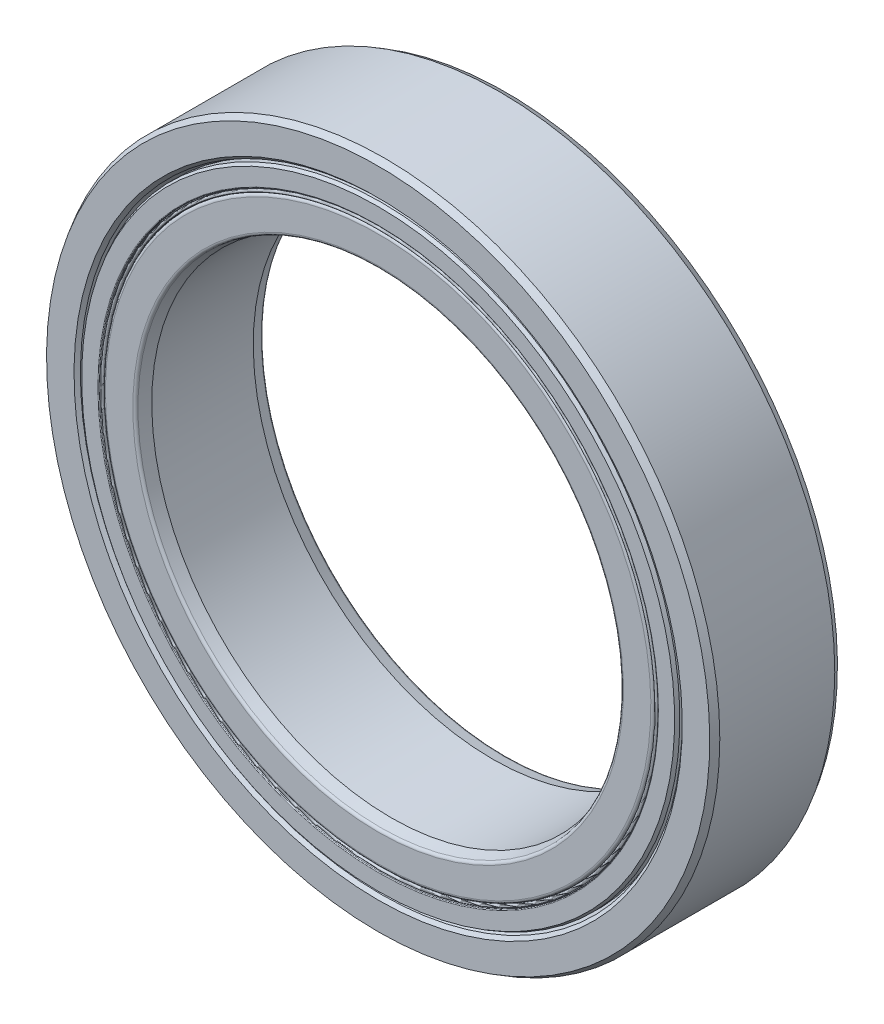
from build123d import *

# Parameters (mm, degrees)
CIRPATTERN1_COUNT = 16


with BuildPart() as part:
    # Sketch3 → Revolve1 (revolve)
    with BuildSketch(Plane(origin=(0, 0, 0), x_dir=(0, 0, -1), z_dir=(1, 0, 0))):
        with BuildLine():
            Line((-1.682987285, 9.345), (-1.9, 9.423986169))
            Line((-1.9, 9.423986169), (-2, 9.523986169))
            Line((-2, 9.523986169), (-2, 10.384529946))
            Line((-2, 10.384529946), (-1.8, 10.5))
            Line((-1.8, 10.5), (1.8, 10.5))
            Line((1.8, 10.5), (2, 10.384529946))
            Line((2, 10.384529946), (2, 9.523986169))
            Line((2, 9.523986169), (1.9, 9.423986169))
            Line((1.9, 9.423986169), (1.682987285, 9.345))
            Line((1.682987285, 9.345), (1.067520492, 9.345))
            ThreePointArc((1.067520492, 9.345), (0, 10.115), (-1.067520492, 9.345))
            Line((-1.067520492, 9.345), (-1.682987285, 9.345))
        make_face()
    revolve(axis=Axis((0, 0, 2), (0, 0, -1)))


with BuildPart() as body_2:
    # Sketch4 → Revolve2 (revolve)
    with BuildSketch(Plane(origin=(0, 0, 0), x_dir=(0, 0, -1), z_dir=(1, 0, 0))):
        with BuildLine():
            Line((-1.589431776, 7.5), (-1.929981412, 7.59125))
            ThreePointArc((-1.929981412, 7.59125), (-1.980478307, 7.624990946), (-2, 7.6825))
            Line((-2, 7.6825), (-2, 8.540531049))
            ThreePointArc((-2, 8.540531049), (-1.972330685, 8.607330685), (-1.905531049, 8.635))
            Line((-1.905531049, 8.635), (-1.067520492, 8.635))
            ThreePointArc((-1.067520492, 8.635), (0, 7.865), (1.067520492, 8.635))
            Line((1.067520492, 8.635), (1.905531049, 8.635))
            ThreePointArc((1.905531049, 8.635), (1.972330685, 8.607330685), (2, 8.540531049))
            Line((2, 8.540531049), (2, 7.6825))
            ThreePointArc((2, 7.6825), (1.980478307, 7.624990946), (1.929981412, 7.59125))
            Line((1.929981412, 7.59125), (1.589431776, 7.5))
            Line((1.589431776, 7.5), (-1.589431776, 7.5))
        make_face()
    revolve(axis=Axis((0, 0, 2), (0, 0, -1)))


with BuildPart() as body_3:
    # Sketch5 → Revolve3 (revolve)
    with BuildSketch(Plane(origin=(0, 0, 0), x_dir=(0, 0, -1), z_dir=(1, 0, 0))):
        with BuildLine():
            Line((-1.125, 8.99), (1.125, 8.99))
            ThreePointArc((1.125, 8.99), (0, 10.115), (-1.125, 8.99))
        make_face()
    revolve(axis=Axis((0, 8.99, 1.125), (0, 0, -1)))


with BuildPart() as cirpattern1_1:
    # CirPattern1: pattern copy
    add(body_3.part.rotate(Axis((0, 0, 2), (0, 0, -1)), 1 * 360 / CIRPATTERN1_COUNT))


with BuildPart() as cirpattern1_2:
    # CirPattern1: pattern copy
    add(body_3.part.rotate(Axis((0, 0, 2), (0, 0, -1)), 2 * 360 / CIRPATTERN1_COUNT))


with BuildPart() as cirpattern1_3:
    # CirPattern1: pattern copy
    add(body_3.part.rotate(Axis((0, 0, 2), (0, 0, -1)), 3 * 360 / CIRPATTERN1_COUNT))


with BuildPart() as cirpattern1_4:
    # CirPattern1: pattern copy
    add(body_3.part.rotate(Axis((0, 0, 2), (0, 0, -1)), 4 * 360 / CIRPATTERN1_COUNT))


with BuildPart() as cirpattern1_5:
    # CirPattern1: pattern copy
    add(body_3.part.rotate(Axis((0, 0, 2), (0, 0, -1)), 5 * 360 / CIRPATTERN1_COUNT))


with BuildPart() as cirpattern1_6:
    # CirPattern1: pattern copy
    add(body_3.part.rotate(Axis((0, 0, 2), (0, 0, -1)), 6 * 360 / CIRPATTERN1_COUNT))


with BuildPart() as cirpattern1_7:
    # CirPattern1: pattern copy
    add(body_3.part.rotate(Axis((0, 0, 2), (0, 0, -1)), 7 * 360 / CIRPATTERN1_COUNT))


with BuildPart() as cirpattern1_8:
    # CirPattern1: pattern copy
    add(body_3.part.rotate(Axis((0, 0, 2), (0, 0, -1)), 8 * 360 / CIRPATTERN1_COUNT))


with BuildPart() as cirpattern1_9:
    # CirPattern1: pattern copy
    add(body_3.part.rotate(Axis((0, 0, 2), (0, 0, -1)), 9 * 360 / CIRPATTERN1_COUNT))


with BuildPart() as cirpattern1_10:
    # CirPattern1: pattern copy
    add(body_3.part.rotate(Axis((0, 0, 2), (0, 0, -1)), 10 * 360 / CIRPATTERN1_COUNT))


with BuildPart() as cirpattern1_11:
    # CirPattern1: pattern copy
    add(body_3.part.rotate(Axis((0, 0, 2), (0, 0, -1)), 11 * 360 / CIRPATTERN1_COUNT))


with BuildPart() as cirpattern1_12:
    # CirPattern1: pattern copy
    add(body_3.part.rotate(Axis((0, 0, 2), (0, 0, -1)), 12 * 360 / CIRPATTERN1_COUNT))


with BuildPart() as cirpattern1_13:
    # CirPattern1: pattern copy
    add(body_3.part.rotate(Axis((0, 0, 2), (0, 0, -1)), 13 * 360 / CIRPATTERN1_COUNT))


with BuildPart() as cirpattern1_14:
    # CirPattern1: pattern copy
    add(body_3.part.rotate(Axis((0, 0, 2), (0, 0, -1)), 14 * 360 / CIRPATTERN1_COUNT))


with BuildPart() as cirpattern1_15:
    # CirPattern1: pattern copy
    add(body_3.part.rotate(Axis((0, 0, 2), (0, 0, -1)), 15 * 360 / CIRPATTERN1_COUNT))


with BuildPart() as body_19:
    # Sketch6 → Revolve4 (revolve)
    with BuildSketch(Plane(origin=(0, 0, 0), x_dir=(0, 0, -1), z_dir=(1, 0, 0))):
        with BuildLine():
            Line((-1.896076952, 9.345), (-1.125, 9.345))
            Line((-1.125, 9.345), (-1.125, 8.755))
            Line((-1.125, 8.755), (-1.976, 8.755))
            ThreePointArc((-1.976, 8.755), (-1.992970563, 8.762029437), (-2, 8.779))
            Line((-2, 8.779), (-2, 9.285))
            Line((-2, 9.285), (-1.896076952, 9.345))
        make_face()
        with BuildLine():
            Line((1.976, 8.755), (1.125, 8.755))
            Line((1.125, 8.755), (1.125, 9.345))
            Line((1.125, 9.345), (1.896076952, 9.345))
            Line((1.896076952, 9.345), (2, 9.285))
            Line((2, 9.285), (2, 8.779))
            ThreePointArc((2, 8.779), (1.992970563, 8.762029437), (1.976, 8.755))
        make_face()
    revolve(axis=Axis((0, 0, 2), (0, 0, -1)))


with BuildPart() as body_20:
    # Sketch7 → Revolve5 (revolve)
    with BuildSketch(Plane(origin=(0, 0, 0), x_dir=(0, 0, -1), z_dir=(1, 0, 0))):
        with BuildLine():
            Line((-1.125, 8.755), (-1.90262466, 8.755))
            Line((-1.90262466, 8.755), (-1.932168892, 8.749790555))
            ThreePointArc((-1.932168892, 8.749790555), (-1.942442625, 8.736401565), (-1.93, 8.725))
            Line((-1.93, 8.725), (-1.955, 8.725))
            ThreePointArc((-1.955, 8.725), (-2, 8.68), (-1.955, 8.635))
            Line((-1.955, 8.635), (-1.125, 8.635))
            Line((-1.125, 8.635), (-1.125, 8.755))
        make_face()
    revolve(axis=Axis((0, 0, 2), (0, 0, -1)))


solid = Compound([part.part, body_2.part, body_3.part, cirpattern1_1.part, cirpattern1_2.part, cirpattern1_3.part, cirpattern1_4.part, cirpattern1_5.part, cirpattern1_6.part, cirpattern1_7.part, cirpattern1_8.part, cirpattern1_9.part, cirpattern1_10.part, cirpattern1_11.part, cirpattern1_12.part, cirpattern1_13.part, cirpattern1_14.part, cirpattern1_15.part, body_19.part, body_20.part])
